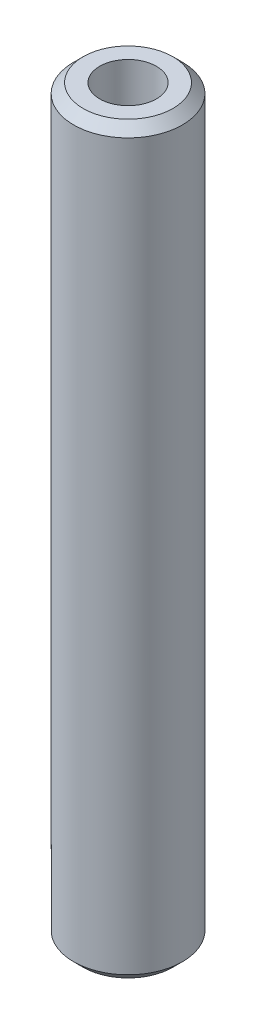
from build123d import *

# Parameters (mm, degrees)
SKETCH1_R           = 15
BOSS_EXTRUDE1_DEPTH = 205.130822305
SKETCH2_R           = 7.818131782
CUT_EXTRUDE1_DEPTH  = 207.224766358
CHAMFER1_SIZE       = 2.620865035


with BuildPart() as part:
    # Sketch1 → Boss-Extrude1 (new body)
    with BuildSketch(Plane(origin=(0, 0, 0), x_dir=(1, 0, 0), z_dir=(0, 1, 0))):
        Circle(SKETCH1_R)
    extrude(amount=BOSS_EXTRUDE1_DEPTH)

    # Sketch2 → Cut-Extrude1 (cut, through all)
    with BuildSketch(Plane(origin=(0, 0, 0), x_dir=(1, 0, 0), z_dir=(0, 1, 0))):
        Circle(SKETCH2_R)
    extrude(amount=CUT_EXTRUDE1_DEPTH, mode=Mode.SUBTRACT)

    # Chamfer1
    chamfer1_edges = [part.edges().sort_by_distance(p)[0] for p in [
        (-15, 205.130822305, 0),
        (-15, 0, 0),
    ]]
    chamfer(chamfer1_edges, length=CHAMFER1_SIZE)


solid = part.part
